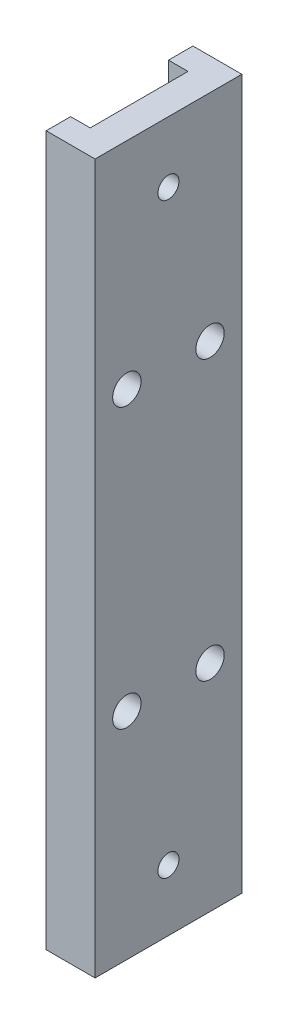
from build123d import *

# Parameters (mm, degrees)
BOSS_EXTRUDE1_DEPTH  = 145
M4_CLEARANCE_HOLE1_D = 4.3
HOLE1_D              = 5.8
HOLE1_DEPTH          = 6


with BuildPart() as part:
    # Sketch1 → Boss-Extrude1 (new body)
    with BuildSketch(Plane(origin=(0, 260, 0), x_dir=(-1, 0, 0), z_dir=(0, -1, 0))):
        Polygon((71.5, -127.5), (61.5, -127.5), (61.5, -97.5), (71.5, -97.5), (71.5, -102.5), (67.5, -102.5), (67.5, -122.5), (71.5, -122.5), align=None)
    extrude(amount=BOSS_EXTRUDE1_DEPTH)

    # M4 Clearance Hole1 (through all)
    with Locations(Plane(origin=(-61.5, 0, 0), x_dir=(0, 0, -1), z_dir=(1, 0, 0))):
        with Locations((-112.5, 247.5), (-112.5, 127.5)):
            Hole(M4_CLEARANCE_HOLE1_D / 2)

    # Hole1
    with Locations(Plane(origin=(-61.5, 0, 0), x_dir=(0, 0, -1), z_dir=(1, 0, 0))):
        with Locations((-104, 216), (-121, 216), (-104, 159), (-121, 159)):
            Hole(HOLE1_D / 2, depth=HOLE1_DEPTH)


solid = part.part
